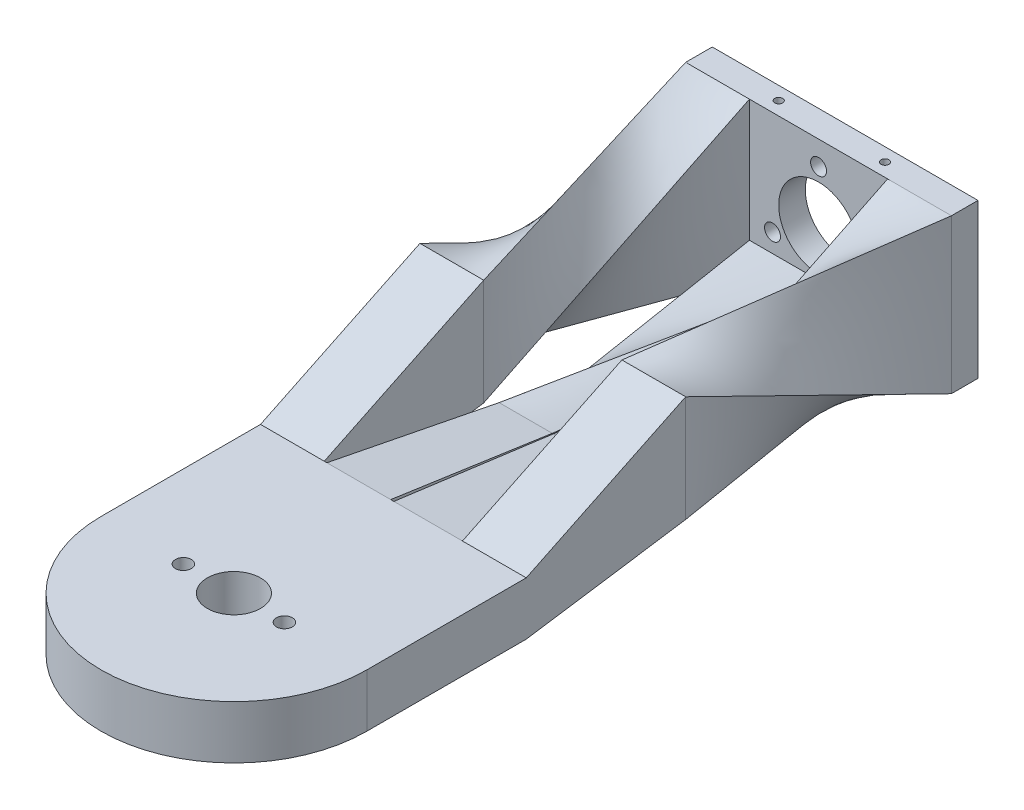
from build123d import *

# Parameters (mm, degrees)
SKETCH_1_W          = 50
SKETCH_1_H          = 29
SKETCH_1_R          = 1.5
SKETCH_1_R_2        = 7.5
EXTRUDE_1_DEPTH     = 5
SKETCH_22_W         = 50
SKETCH_22_H         = 10
EXTRUDE_2_DEPTH     = 30
EXTRUDE_3_DEPTH     = 10
SKETCH_25_R         = 5
SKETCH_25_R_2       = 1.5
CUT_EXTRUDE_1_DEPTH = 144.478221472
SKETCH_26_R         = 0.75
CUT_EXTRUDE_2_DEPTH = 5


with BuildPart() as part:
    # 草圖1 → 填料-伸長1 (new body)
    with BuildSketch(Plane.XY):
        Rectangle(SKETCH_1_W, SKETCH_1_H)
        with Locations((0, 10)):
            Circle(SKETCH_1_R, mode=Mode.SUBTRACT)
        with Locations((-8.660254038, -5)):
            Circle(SKETCH_1_R, mode=Mode.SUBTRACT)
        with Locations((8.660254038, -5)):
            Circle(SKETCH_1_R, mode=Mode.SUBTRACT)
        Circle(SKETCH_1_R_2, mode=Mode.SUBTRACT)
    extrude(amount=EXTRUDE_1_DEPTH)

    # 疊層拉伸2: read off the stored shape, not the designer's step
    # 疊層拉伸2: loft between two sections, ruled curve by curve
    loft_2_from = [
        Edge.make_bspline([(-13, 10, 55), (-13, 6.666666667, 55), (-13, 3.333333333, 55), (-13, -3.333333333, 55), (-13, -6.666666667, 55), (-13, -10, 55)], [0, 0, 0, 0, 0.5, 0.5, 1, 1, 1, 1], 3),
        Edge.make_bspline([(-13, -10, 55), (-15, -10, 55), (-17, -10, 55), (-21, -10, 55), (-23, -10, 55), (-25, -10, 55)], [0, 0, 0, 0, 0.5, 0.5, 1, 1, 1, 1], 3),
        Edge.make_bspline([(-25, 10, 55), (-23, 10, 55), (-21, 10, 55), (-17, 10, 55), (-15, 10, 55), (-13, 10, 55)], [0, 0, 0, 0, 0.5, 0.5, 1, 1, 1, 1], 3),
        Edge.make_bspline([(-25, -10, 55), (-25, -6.666666667, 55), (-25, -3.333333333, 55), (-25, 3.333333333, 55), (-25, 6.666666667, 55), (-25, 10, 55)], [0, 0, 0, 0, 0.5, 0.5, 1, 1, 1, 1], 3),
    ]
    loft_2_to = [
        Edge.make_bspline([(-25, 14.5, 5), (-23, 14.5, 5), (-21, 14.5, 5), (-17, 14.5, 5), (-15, 14.5, 5), (-13, 14.5, 5)], [0, 0, 0, 0, 0.5, 0.5, 1, 1, 1, 1], 3),
        Edge.make_bspline([(-13, 14.5, 5), (-13, 9.666666667, 5), (-13, 4.833333333, 5), (-13, -4.833333333, 5), (-13, -9.666666667, 5), (-13, -14.5, 5)], [0, 0, 0, 0, 0.5, 0.5, 1, 1, 1, 1], 3),
        Edge.make_bspline([(-25, -14.5, 5), (-25, -9.666666667, 5), (-25, -4.833333333, 5), (-25, 4.833333333, 5), (-25, 9.666666667, 5), (-25, 14.5, 5)], [0, 0, 0, 0, 0.5, 0.5, 1, 1, 1, 1], 3),
        Edge.make_bspline([(-13, -14.5, 5), (-15, -14.5, 5), (-17, -14.5, 5), (-21, -14.5, 5), (-23, -14.5, 5), (-25, -14.5, 5)], [0, 0, 0, 0, 0.5, 0.5, 1, 1, 1, 1], 3),
    ]
    loft_2 = Solid(Shell([*[Face.make_surface_from_curves(loft_2_from[k], loft_2_to[k]) for k in range(4)], Face(Wire(loft_2_from)), Face(Wire(loft_2_to))]))
    add(loft_2)

    # 疊層拉伸7: read off the stored shape, not the designer's step
    # 疊層拉伸7: loft between two sections, ruled curve by curve
    loft_7_from = [
        Edge.make_bspline([(-0.1, -8.5, 5), (-2.25, -8.5, 5), (-4.4, -8.5, 5), (-8.7, -8.5, 5), (-10.85, -8.5, 5), (-13, -8.5, 5)], [0, 0, 0, 0, 0.5, 0.5, 1, 1, 1, 1], 3),
        Edge.make_bspline([(-13, -8.5, 5), (-13, -9.5, 5), (-13, -10.5, 5), (-13, -12.5, 5), (-13, -13.5, 5), (-13, -14.5, 5)], [0, 0, 0, 0, 0.5, 0.5, 1, 1, 1, 1], 3),
        Edge.make_bspline([(-0.1, -14.5, 5), (-0.1, -13.5, 5), (-0.1, -12.5, 5), (-0.1, -10.5, 5), (-0.1, -9.5, 5), (-0.1, -8.5, 5)], [0, 0, 0, 0, 0.5, 0.5, 1, 1, 1, 1], 3),
        Edge.make_bspline([(-13, -14.5, 5), (-10.85, -14.5, 5), (-8.7, -14.5, 5), (-4.4, -14.5, 5), (-2.25, -14.5, 5), (-0.1, -14.5, 5)], [0, 0, 0, 0, 0.5, 0.5, 1, 1, 1, 1], 3),
    ]
    loft_7_to = [
        Edge.make_bspline([(-10.1, -8.5, 55), (-10.1, -9.5, 55), (-10.1, -10.5, 55), (-10.1, -12.5, 55), (-10.1, -13.5, 55), (-10.1, -14.5, 55)], [0, 0, 0, 0, 0.5, 0.5, 1, 1, 1, 1], 3),
        Edge.make_bspline([(-10.1, -14.5, 55), (-8.433333333, -14.5, 55), (-6.766666667, -14.5, 55), (-3.433333333, -14.5, 55), (-1.766666667, -14.5, 55), (-0.1, -14.5, 55)], [0, 0, 0, 0, 0.5, 0.5, 1, 1, 1, 1], 3),
        Edge.make_bspline([(-0.1, -8.5, 55), (-1.766666667, -8.5, 55), (-3.433333333, -8.5, 55), (-6.766666667, -8.5, 55), (-8.433333333, -8.5, 55), (-10.1, -8.5, 55)], [0, 0, 0, 0, 0.5, 0.5, 1, 1, 1, 1], 3),
        Edge.make_bspline([(-0.1, -14.5, 55), (-0.1, -13.5, 55), (-0.1, -12.5, 55), (-0.1, -10.5, 55), (-0.1, -9.5, 55), (-0.1, -8.5, 55)], [0, 0, 0, 0, 0.5, 0.5, 1, 1, 1, 1], 3),
    ]
    loft_7 = Solid(Shell([*[Face.make_surface_from_curves(loft_7_from[k], loft_7_to[k]) for k in range(4)], Face(Wire(loft_7_from)), Face(Wire(loft_7_to))]))
    add(loft_7)

    # 草圖17 → section 1 of loft_13
    with BuildSketch(Plane.XY.offset(85), mode=Mode.PRIVATE) as loft_13_s1:
        with BuildLine():
            Line((-25, -14.5), (-13, -14.5))
            Line((-13, -14.5), (-13, -4.5))
            Line((-13, -4.5), (-25, -4.5))
            Line((-25, -4.5), (-25, -14.5))
        make_face()
    # loft from a face of the part (loft_13)
    loft([part.faces().sort_by_distance((-19, 0, 55))[0], loft_13_s1.sketch])

    # 草圖19 → section 0 of loft_14
    with BuildSketch(Plane.XY.offset(85), mode=Mode.PRIVATE) as loft_14_s0:
        with BuildLine():
            Line((-12.5, -14.5), (-0.5, -14.5))
            Line((-0.5, -14.5), (-0.5, -4.5))
            Line((-0.5, -4.5), (-12.5, -4.5))
            Line((-12.5, -4.5), (-12.5, -14.5))
        make_face()
    # loft up to a face of the part (loft_14)
    loft([loft_14_s0.sketch, part.faces().sort_by_distance((-5.1, -11.5, 55))[0]])

    # 鏡射5: 疊層拉伸2, 疊層拉伸7 across plane
    add(loft_2.mirror(Plane.ZY))
    add(loft_7.mirror(Plane.ZY))

    # 草圖20 → section 0 of loft_15
    with BuildSketch(Plane.XY.offset(85), mode=Mode.PRIVATE) as loft_15_s0:
        with BuildLine():
            Line((25, -4.5), (13, -4.5))
            Line((13, -4.5), (13, -14.5))
            Line((13, -14.5), (25, -14.5))
            Line((25, -14.5), (25, -4.5))
        make_face()
    # loft up to a face of the part (loft_15)
    loft([loft_15_s0.sketch, part.faces().sort_by_distance((19, 0, 55))[0]])

    # 草圖21 → section 1 of loft_16
    with BuildSketch(Plane.XY.offset(85), mode=Mode.PRIVATE) as loft_16_s1:
        with BuildLine():
            Line((0.1, -14.5), (12.9, -14.5))
            Line((12.9, -14.5), (12.9, -4.5))
            Line((12.9, -4.5), (0.1, -4.5))
            Line((0.1, -4.5), (0.1, -14.5))
        make_face()
    # loft from a face of the part (loft_16)
    loft([part.faces().sort_by_distance((5.1, -11.5, 55))[0], loft_16_s1.sketch])

    # 草圖22 → 填料-伸長2 (add)
    with BuildSketch(Plane.XY.offset(85)):
        with Locations((0, -9.5)):
            Rectangle(SKETCH_22_W, SKETCH_22_H)
    extrude(amount=EXTRUDE_2_DEPTH)

    # 草圖23 → 填料-伸長3 (add)
    with BuildSketch(Plane(origin=(0, -4.5, 0), x_dir=(1, 0, 0), z_dir=(0, 1, 0))):
        with BuildLine():
            Line((-25, -115), (25, -115))
            ThreePointArc((25, -115), (0, -140), (-25, -115))
        make_face()
    extrude(amount=-EXTRUDE_3_DEPTH)

    # 草圖25 → 除料-伸長1 (cut, through all)
    with BuildSketch(Plane(origin=(0, -4.5, 0), x_dir=(1, 0, 0), z_dir=(0, 1, 0))):
        with Locations(Location((0, -115, 0), (0, 0, 270))):
            Circle(SKETCH_25_R)
        with Locations(Location((9.5, -115, 0), (0, 0, 270))):
            Circle(SKETCH_25_R_2)
        with Locations(Location((-9.5, -115, 0), (0, 0, 270))):
            Circle(SKETCH_25_R_2)
    extrude(amount=-CUT_EXTRUDE_1_DEPTH, mode=Mode.SUBTRACT)

    # 草圖26 → 除料-伸長2 (cut)
    with BuildSketch(Plane(origin=(0, 14.5, 0), x_dir=(1, 0, 0), z_dir=(0, 1, 0))):
        with Locations(Location((-10, -2.5, 0), (0, 0, 270))):
            Circle(SKETCH_26_R)
        with Locations(Location((10, -2.5, 0), (0, 0, 270))):
            Circle(SKETCH_26_R)
    extrude(amount=-CUT_EXTRUDE_2_DEPTH, mode=Mode.SUBTRACT)


solid = part.part
